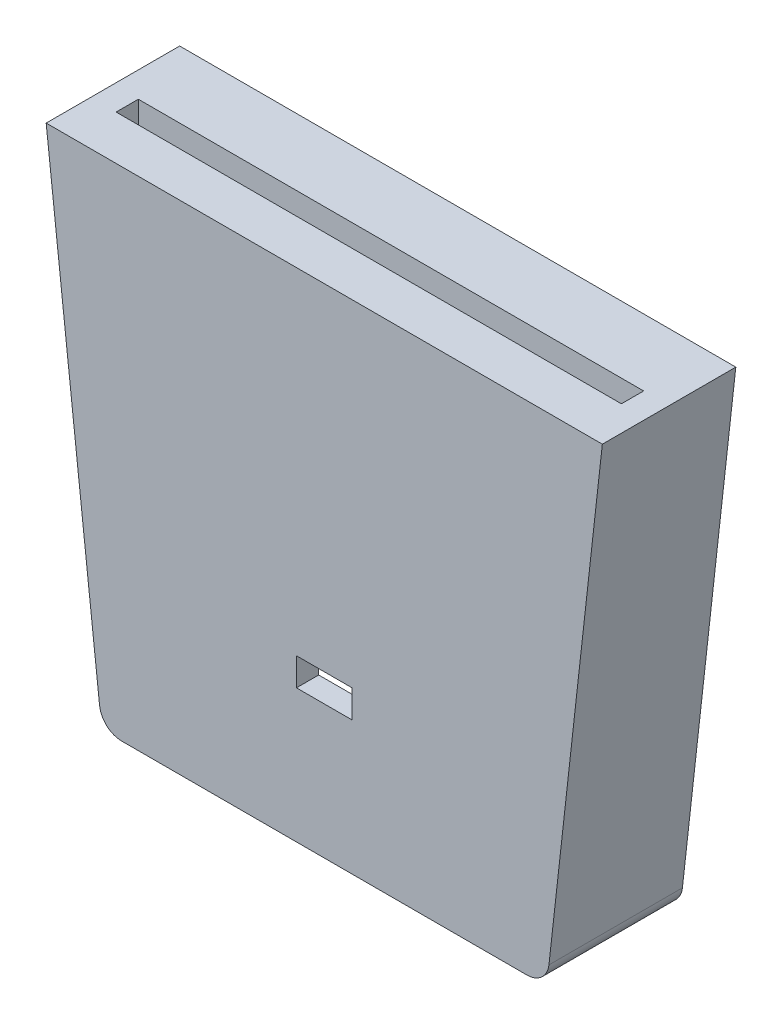
from build123d import *

# Parameters (mm, degrees)
SKETCH1_W           = 12.7
SKETCH1_H           = 6.35
BOSS_EXTRUDE1_DEPTH = 5.08
BOSS_EXTRUDE2_DEPTH = 25.4
SKETCH4_W           = 115.38555028
SKETCH4_H           = 5.08
CUT_EXTRUDE1_DEPTH  = 5.08
BOSS_EXTRUDE3_DEPTH = 2.54
SKETCH7_R           = 1.905
CUT_EXTRUDE2_DEPTH  = 2.54


with BuildPart() as part:
    # Sketch1 → Boss-Extrude1 (new body)
    with BuildSketch(Plane.XY):
        with BuildLine():
            Line((63.5, 56.7961272), (-63.5, 56.7961272))
            Line((-63.5, 56.7961272), (-51.304854459, -52.280570501))
            ThreePointArc((-51.304854459, -52.280570501), (-49.642976536, -55.502534499), (-46.25630987, -56.796126057))
            Line((-46.25630987, -56.796126057), (46.25630987, -56.796126057))
            ThreePointArc((46.25630987, -56.796126057), (49.642976536, -55.502534499), (51.304854459, -52.280570501))
            Line((51.304854459, -52.280570501), (63.5, 56.7961272))
        make_face()
        with Locations((0, -23.141126057)):
            Rectangle(SKETCH1_W, SKETCH1_H, mode=Mode.SUBTRACT)
    extrude(amount=-BOSS_EXTRUDE1_DEPTH)

    # Sketch2 → Boss-Extrude2 (add)
    with BuildSketch(Plane.XY.offset(-5.08)):
        with BuildLine():
            Line((63.5, 56.7961272), (-63.5, 56.7961272))
            Line((-63.5, 56.7961272), (-51.304854459, -52.280570501))
            ThreePointArc((-51.304854459, -52.280570501), (-49.642976536, -55.502534499), (-46.25630987, -56.796126057))
            Line((-46.25630987, -56.796126057), (46.25630987, -56.796126057))
            ThreePointArc((46.25630987, -56.796126057), (49.642976536, -55.502534499), (51.304854459, -52.280570501))
            Line((51.304854459, -52.280570501), (63.5, 56.7961272))
        make_face()
        with BuildLine():
            Line((41.712619739, -51.716126057), (-41.712619739, -51.716126057))
            ThreePointArc((-41.712619739, -51.716126057), (-45.099286406, -50.422534499), (-46.761164329, -47.200570501))
            Line((-46.761164329, -47.200570501), (-57.820387337, 51.7161272))
            Line((-57.820387337, 51.7161272), (57.820387337, 51.7161272))
            Line((57.820387337, 51.7161272), (46.761164329, -47.200570501))
            ThreePointArc((46.761164329, -47.200570501), (45.099286406, -50.422534499), (41.712619739, -51.716126057))
        make_face(mode=Mode.SUBTRACT)
    extrude(amount=-BOSS_EXTRUDE2_DEPTH)

    # Sketch4 → Cut-Extrude1 (cut)
    with BuildSketch(Plane(origin=(0, 56.7961272, -56.7961272), x_dir=(1, 0, 0), z_dir=(0, -1, 0))):
        with Locations((2.54e-06, 44.0961272)):
            Rectangle(SKETCH4_W, SKETCH4_H)
    extrude(amount=CUT_EXTRUDE1_DEPTH, mode=Mode.SUBTRACT)

    # Sketch6 → Boss-Extrude3 (add)
    with BuildSketch(Plane.XY.offset(-30.48)):
        Polygon((-52.99583525, 8.564021488), (-33.94583525, 8.564021488), (-33.94583525, -4.135978512), (-51.575932084, -4.135978512), align=None)
        Polygon((33.94583525, -4.135978512), (51.575932084, -4.135978512), (52.99583525, 8.564021488), (33.94583525, 8.564021488), align=None)
    extrude(amount=BOSS_EXTRUDE3_DEPTH)

    # Sketch7 → Cut-Extrude2 (cut)
    with BuildSketch(Plane.XY.offset(-30.48)):
        with Locations((-43.115859459, 2.214021488)):
            Circle(SKETCH7_R)
        with Locations((43.115859459, 2.214021488)):
            Circle(SKETCH7_R)
    extrude(amount=CUT_EXTRUDE2_DEPTH, mode=Mode.SUBTRACT)


solid = part.part
